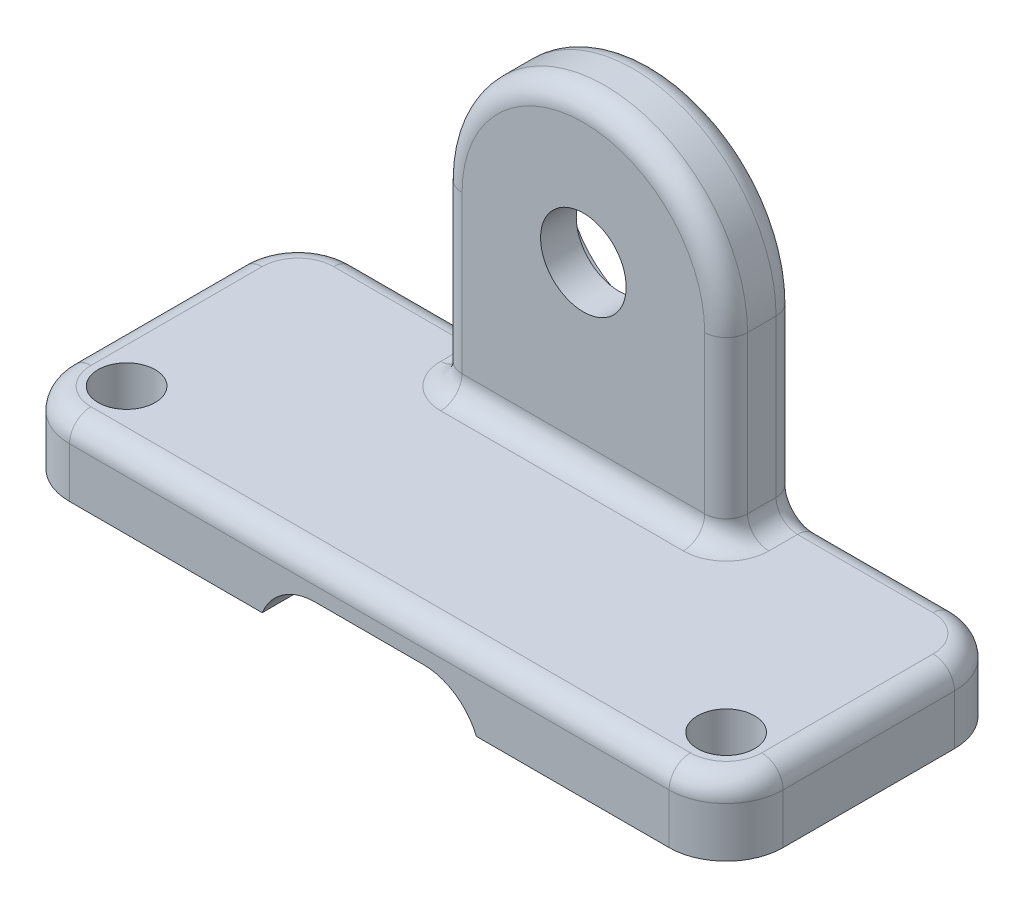
from build123d import *

# Parameters (mm, degrees)
SKETCH_3_W          = 100
SKETCH_3_H          = 40
EXTRUDE_1_DEPTH     = 10
EXTRUDE_3_DEPTH     = 10
SKETCH_6_R          = 12.5
CUT_EXTRUDE_1_DEPTH = 5
SKETCH_8_R          = 6
CUT_EXTRUDE_2_DEPTH = 5
SKETCH_9_W          = 30
SKETCH_9_H          = 5
CUT_EXTRUDE_4_DEPTH = 85.409715081
FILLET_1_R          = 8
SKETCH_12_R         = 4
CUT_EXTRUDE_6_DEPTH = 71.178344238
FILLET_2_R          = 3


with BuildPart() as part:
    # Эскиз3 → Бобышка-Вытянуть1 (new body)
    with BuildSketch(Plane(origin=(0, 0, 0), x_dir=(1, 0, 0), z_dir=(0, 1, 0))):
        Rectangle(SKETCH_3_W, SKETCH_3_H)
    extrude(amount=EXTRUDE_1_DEPTH)

    # Эскиз4 → Бобышка-Вытянуть3 (add)
    with BuildSketch(Plane(origin=(0, 0, -20), x_dir=(-1, 0, 0), z_dir=(0, 0, -1))):
        with BuildLine():
            Line((-20, 0), (-20, 35))
            ThreePointArc((-20, 35), (0, 55), (20, 35))
            Line((20, 35), (20, 0))
            Line((20, 0), (-20, 0))
        make_face()
    extrude(amount=-EXTRUDE_3_DEPTH)

    # Эскиз6 → Вырез-Вытянуть1 (cut)
    with BuildSketch(Plane(origin=(0, 0, -20), x_dir=(-1, 0, 0), z_dir=(0, 0, -1))):
        with Locations((0, 35)):
            Circle(SKETCH_6_R)
    extrude(amount=-CUT_EXTRUDE_1_DEPTH, mode=Mode.SUBTRACT)

    # Эскиз8 → Вырез-Вытянуть2 (cut)
    with BuildSketch(Plane(origin=(0, 0, -15), x_dir=(-1, 0, 0), z_dir=(0, 0, -1))):
        with Locations((0, 35)):
            Circle(SKETCH_8_R)
    extrude(amount=-CUT_EXTRUDE_2_DEPTH, mode=Mode.SUBTRACT)

    # Эскиз9 → Вырез-Вытянуть4 (cut, through all)
    with BuildSketch(Plane(origin=(0, 0, -20), x_dir=(-1, 0, 0), z_dir=(0, 0, -1))):
        with Locations((0, 2.5)):
            Rectangle(SKETCH_9_W, SKETCH_9_H)
    extrude(amount=-CUT_EXTRUDE_4_DEPTH, mode=Mode.SUBTRACT)

    # Скругление1
    # the kernel refuses this fillet: 8 mm, written as the material it adds along each edge
    with BuildSketch(Plane(origin=(-15, 5, -20), x_dir=(0, -1, 0), z_dir=(0, 0, 1))) as fillet_1_piece_1:
        with BuildLine():
            CenterArc((8, 7.416198487), FILLET_1_R, 180, 67.975687163)
            Line((0, 7.416198487), (0, 0))
            Line((0, 0), (5, 0))
        make_face()
    extrude(amount=40)
    with BuildSketch(Plane(origin=(15, 5, -20), x_dir=(-1, 0, 0), z_dir=(0, 0, 1))) as fillet_1_piece_2:
        with BuildLine():
            CenterArc((7.416198487, 8), FILLET_1_R, 202.024312837, 67.975687163)
            Line((0, 5), (0, 0))
            Line((0, 0), (7.416198487, 0))
        make_face()
    extrude(amount=40)
    # the kernel refuses this fillet: 8 mm, written as the material it takes off along each edge
    with BuildSketch(Plane(origin=(-50, -20, 20), x_dir=(0, 0, -1), z_dir=(0, 1, 0)), Plane(origin=(-50, -20, -20), x_dir=(1, 0, 0), z_dir=(0, 1, 0))) as fillet_1_2_piece_1:
        with BuildLine():
            CenterArc((FILLET_1_R, -FILLET_1_R), FILLET_1_R, 90, 90)
            Line((0, -FILLET_1_R), (0, 0))
            Line((0, 0), (FILLET_1_R, 0))
        make_face()
    extrude(amount=50, mode=Mode.SUBTRACT)
    with BuildSketch(Plane(origin=(50, -20, 20), x_dir=(0, 0, -1), z_dir=(0, 1, 0)), Plane(origin=(50, -20, -20), x_dir=(-1, 0, 0), z_dir=(0, 1, 0))) as fillet_1_2_piece_2:
        with BuildLine():
            CenterArc((FILLET_1_R, FILLET_1_R), FILLET_1_R, 180, 90)
            Line((0, FILLET_1_R), (0, 0))
            Line((0, 0), (FILLET_1_R, 0))
        make_face()
    extrude(amount=50, mode=Mode.SUBTRACT)

    # Эскиз12 → Вырез-Вытянуть6 (cut, through all)
    with BuildSketch(Plane(origin=(0, 10, 0), x_dir=(1, 0, 0), z_dir=(0, 1, 0))):
        with Locations(Location((-42, -12, 0), (0, 0, 270))):
            Circle(SKETCH_12_R)
        with Locations(Location((42, -12, 0), (0, 0, 90))):
            Circle(SKETCH_12_R)
    extrude(amount=-CUT_EXTRUDE_6_DEPTH, mode=Mode.SUBTRACT)

    # Скругление2
    fillet_2_edges = [part.edges().sort_by_distance(p)[0] for p in [
        (31, 10, -20),
        (20, 10, -15),
        (-20, 10, -15),
        (20, 22.5, -20),
        (0, 55, -20),
        (-20, 22.5, -20),
        (-20, 22.5, -10),
        (0, 10, -10),
        (20, 22.5, -10),
        (0, 55, -10),
        (0, 10, 20),
        (-50, 10, 0),
        (-31, 10, -20),
        (50, 10, 0),
        (47.656854249, 10, -17.656854249),
        (47.656854249, 10, 17.656854249),
        (-47.656854249, 10, -17.656854249),
        (-47.656854249, 10, 17.656854249),
    ]]
    fillet(fillet_2_edges, radius=FILLET_2_R)


solid = part.part
